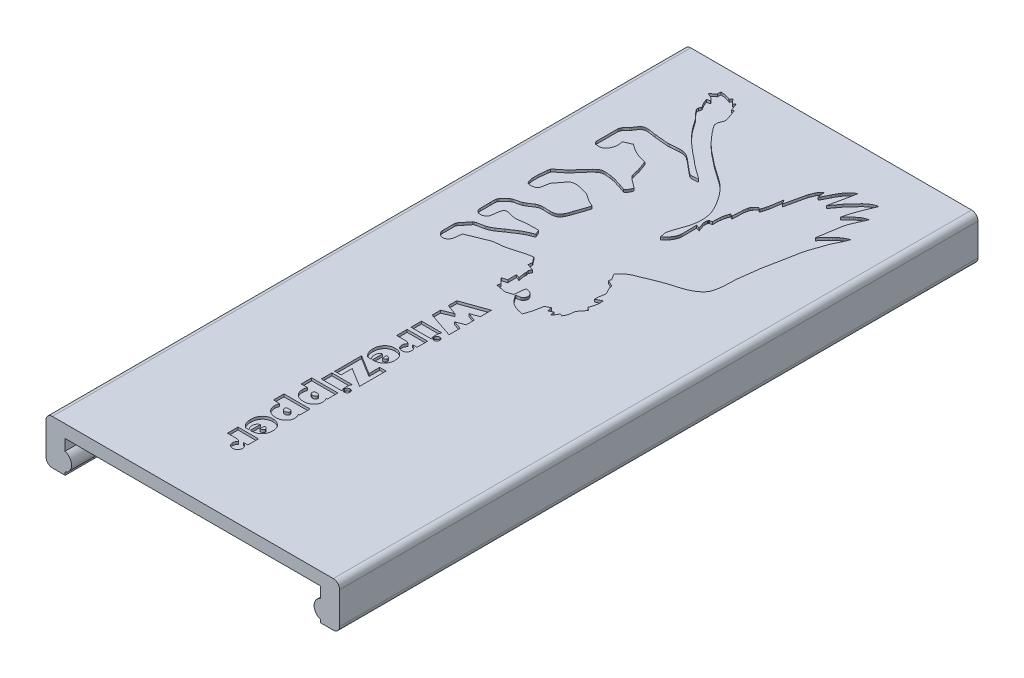
from build123d import *

# Parameters (mm, degrees)
BOSS_EXTRUDE1_DEPTH = 50
CUT_EXTRUDE1_DEPTH  = 0.2
CUT_EXTRUDE3_DEPTH  = 0.2


with BuildPart() as part:
    # Sketch1 → Boss-Extrude1 (new body)
    with BuildSketch(Plane.XY):
        with BuildLine():
            Line((21.5, 0), (22.5, 0))
            ThreePointArc((22.5, 0), (22.853553391, 0.146446609), (23, 0.5))
            Line((23, 0.5), (23, 3))
            ThreePointArc((23, 3), (22.853553391, 3.353553391), (22.5, 3.5))
            Line((22.5, 3.5), (0.5, 3.5))
            ThreePointArc((0.5, 3.5), (0.146446609, 3.353553391), (0, 3))
            Line((0, 3), (0, 0.5))
            ThreePointArc((0, 0.5), (0.146446609, 0.146446609), (0.5, 0))
            Line((0.5, 0), (1.5, 0))
            Line((1.5, 0), (1.5, 0.22281926))
            ThreePointArc((1.5, 0.22281926), (2, 0.929926042), (1.5, 1.637032823))
            Line((1.5, 1.637032823), (1.5, 2.5))
            Line((1.5, 2.5), (21.5, 2.5))
            Line((21.5, 2.5), (21.5, 1.637032823))
            ThreePointArc((21.5, 1.637032823), (21, 0.929926042), (21.5, 0.22281926))
            Line((21.5, 0.22281926), (21.5, 0))
        make_face()
    extrude(amount=BOSS_EXTRUDE1_DEPTH)

    # Sketch2 → Cut-Extrude1 (cut)
    with BuildSketch(Plane(origin=(0, 3.5, -61.263245551), x_dir=(1, 0, 0), z_dir=(0, 1, 0))):
        Polygon((19.745567043, -68.104601105), (19.771329957, -68.016192319), (19.70560115, -68.038746064), (19.64138336, -68.063779757), (19.578619421, -68.091182355), (19.517252165, -68.120842815), (19.457224424, -68.152650096), (19.39847903, -68.186493155), (19.340958816, -68.22226095), (19.284606615, -68.25984244), (19.229365259, -68.299126581), (19.175177579, -68.340002332), (19.12198641, -68.382358651), (19.069734583, -68.426084496), (19.018364931, -68.471068823), (18.918043479, -68.564368759), (18.772748422, -68.710981234), (18.269777505, -69.271361386), (18.281217218, -69.152948654), (18.534959056, -67.569138215), (18.544005901, -67.509503112), (18.554730191, -67.450416977), (18.56703761, -67.391848979), (18.580833842, -67.333768285), (18.612515474, -67.218945481), (18.649020551, -67.105701905), (18.711171581, -66.93825803), (19.047435047, -66.172036884), (19.133726594, -65.94994016), (19.076628488, -65.960005663), (19.0210055, -65.972912087), (18.966794939, -65.988522881), (18.913934115, -66.006701499), (18.862360336, -66.027311391), (18.812010911, -66.05021601), (18.762823149, -66.075278807), (18.71473436, -66.102363235), (18.667681851, -66.131332743), (18.621602933, -66.162050786), (18.576434914, -66.194380813), (18.532115103, -66.228186277), (18.445769342, -66.299677323), (18.362064121, -66.375431536), (18.200569188, -66.535359923), (17.84770658, -66.896305725), (17.884657267, -66.736955957), (17.968344054, -66.421133138), (18.063839559, -66.108907692), (18.225973101, -65.646689184), (18.633040198, -64.666178627), (18.599411796, -64.669771971), (18.533227498, -64.680575674), (18.468456628, -64.695924518), (18.405079291, -64.715485446), (18.312582633, -64.751995932), (18.2231095, -64.796110162), (18.080524168, -64.883478066), (17.794211119, -65.113398916), (17.069099288, -65.909145003), (16.828722484, -66.241607928), (16.513006588, -66.656341035), (16.794160411, -65.369006265), (16.941861286, -64.59631034), (16.870777867, -64.636264025), (16.802816891, -64.679249232), (16.737833191, -64.725113573), (16.675681599, -64.773704659), (16.616216947, -64.824870101), (16.559294067, -64.87845751), (16.504767792, -64.934314498), (16.452492954, -64.992288676), (16.402324385, -65.052227654), (16.354116917, -65.113979045), (16.307725383, -65.177390459), (16.263004615, -65.242309509), (16.219809445, -65.308583804), (16.177994705, -65.376060956), (16.097925845, -65.514014276), (15.98454659, -65.726155966), (15.693970925, -66.293387042), (15.617711182, -66.428936729), (15.54903134, -65.848423204), (15.522460267, -65.865064365), (15.472343148, -65.901302245), (15.426048379, -65.941194805), (15.383322735, -65.984398764), (15.34391299, -66.030570845), (15.290461754, -66.104643271), (15.228435653, -66.210590997), (15.076480483, -66.580017015), (15.040869472, -66.693542611), (14.686293126, -68.258406048), (14.474940792, -67.937489416), (14.445551284, -68.104829917), (14.310577684, -68.947591988), (14.271183579, -69.113223294), (14.240015457, -69.222374291), (14.204192452, -69.330305289), (14.163088355, -69.436841345), (14.140360206, -69.489531601), (14.116076957, -69.541807517), (13.981394714, -69.409464834), (13.758050972, -69.632820298), (13.676716055, -69.754194358), (13.642544144, -69.830846835), (13.624269592, -69.89243466), (13.614813809, -69.932350891), (13.591969798, -70.052722709), (13.568864821, -70.255035201), (13.529664818, -71.070500793), (13.334094675, -70.96058259), (13.302168255, -71.042533388), (13.24802945, -71.209136729), (13.206156478, -71.378791597), (13.169809605, -71.594144463), (13.14752875, -71.855680811), (13.149463132, -72.206015635), (12.963703448, -72.245338409), (12.919499216, -72.274044131), (12.898916729, -72.298983789), (12.888280793, -72.319488077), (12.880455427, -72.34346579), (12.874040289, -72.372947136), (12.865584292, -72.431757942), (12.862523692, -72.490347444), (12.864334122, -72.548693093), (12.870491214, -72.606772342), (12.893747912, -72.722041444), (13.055767611, -73.167952174), (12.76260984, -73.058920113), (12.772836021, -74.2235194), (12.769441063, -74.267985594), (12.764247026, -74.311940293), (12.757306122, -74.355374587), (12.748670559, -74.398279565), (12.738392549, -74.440646318), (12.7265243, -74.482465934), (12.713118023, -74.523729503), (12.698225927, -74.564428116), (12.681900222, -74.604552862), (12.664193119, -74.644094829), (12.624843556, -74.721394791), (12.580594918, -74.796256719), (12.531864882, -74.868609329), (12.479071129, -74.938381339), (12.422631337, -75.005501468), (12.332049001, -75.10105345), (12.235612524, -75.190237731), (12.134731573, -75.272813733), (12.046286421, -74.820815745), (12.0572263, -74.751406038), (12.070060076, -74.682497303), (12.08463885, -74.614050506), (12.100813721, -74.546026613), (12.137356163, -74.411091404), (12.200418082, -74.210884521), (12.455179307, -73.483307548), (12.495149159, -73.349414391), (12.530187067, -73.214246266), (12.545484294, -73.146086506), (12.559101837, -73.077490902), (12.570890798, -73.008420419), (12.580702278, -72.938836025), (12.588387376, -72.868698685), (12.59464246, -72.810642899), (12.603824389, -72.694131792), (12.608519809, -72.577268101), (12.608670092, -72.460267982), (12.604216612, -72.343347591), (12.595100741, -72.226723086), (12.581263852, -72.110610622), (12.562647316, -71.995226355), (12.539192508, -71.880786442), (12.510840798, -71.767507038), (12.47753356, -71.655604302), (12.439212167, -71.545294387), (12.39581799, -71.436793452), (12.347292403, -71.330317652), (12.293576778, -71.226083144), (12.153611462, -70.972593632), (12.055622325, -70.8055721), (11.953676271, -70.640627802), (11.847590064, -70.478189353), (11.737180466, -70.318685371), (11.622264242, -70.162544472), (11.563058883, -70.085869122), (11.502658155, -70.010195274), (11.441039151, -69.935576505), (11.378178968, -69.862066392), (11.314054701, -69.789718512), (11.248643446, -69.718586443), (11.181922298, -69.648723762), (11.113868352, -69.580184045), (11.044458704, -69.513020869), (10.973670449, -69.447287813), (10.901480682, -69.383038452), (10.8278665, -69.320326365), (10.752804998, -69.259205127), (10.676273271, -69.199728316), (10.598248414, -69.14194951), (10.518707523, -69.085922285), (9.445158783, -68.330045283), (9.377323265, -68.286704215), (8.529964041, -67.61150044), (8.336111467, -67.454739788), (8.147528972, -67.291868199), (7.90408908, -67.065842996), (7.669551492, -66.830496664), (7.443649508, -66.586710778), (7.173009545, -66.271453322), (6.864769026, -65.879980377), (6.709729802, -65.656858788), (6.656644684, -65.543795663), (6.640724685, -65.474324633), (6.637953976, -65.419306649), (6.637039488, -65.393399508), (6.637876621, -65.367752405), (6.640315856, -65.342344663), (6.649402561, -65.292164545), (6.663103453, -65.24269372), (6.767484106, -64.975890107), (6.787730528, -64.902361955), (6.795283594, -64.852609955), (6.796828208, -64.827451949), (6.796685517, -64.802078367), (6.794706002, -64.77646853), (6.790740146, -64.75060176), (6.78463843, -64.724457376), (6.776251336, -64.698014701), (6.478949583, -63.833852049), (6.316198754, -63.871944585), (6.081407246, -63.266668763), (5.943714714, -63.442255947), (5.617870925, -63.080333737), (5.499302591, -63.247135679), (5.418185032, -63.212665539), (5.083167801, -63.109789756), (4.852038362, -63.078852692), (4.675548278, -63.079290725), (4.667182278, -63.332341528), (4.3028609, -63.683744915), (4.436380901, -63.74543469), (4.682235799, -63.862000094), (4.740558774, -63.903978471), (4.775654331, -63.93618192), (4.807122862, -63.972386928), (4.821336845, -63.992158035), (4.834451894, -64.013131153), (4.846403949, -64.035373491), (4.857128952, -64.058952255), (4.866562843, -64.083934652), (4.619415738, -64.138096574), (4.636424293, -64.21830065), (4.696572924, -64.397852828), (4.954743423, -64.842439101), (4.882509129, -65.057092669), (4.880850914, -65.175763412), (4.901269108, -65.22048276), (4.962643763, -65.325273315), (5.32889596, -65.714175511), (5.354305854, -65.737196295), (5.426177903, -65.809786685), (5.534157903, -65.940347595), (5.924220438, -66.497400316), (5.994118086, -66.591179891), (6.065464319, -66.683663429), (6.138209009, -66.774888771), (6.212302028, -66.86489376), (6.287693249, -66.953716237), (6.364332545, -67.041394044), (6.442169787, -67.127965023), (6.521154849, -67.213467015), (6.601237603, -67.297937861), (6.764495676, -67.463937487), (6.931542986, -67.626266632), (7.101978513, -67.785228032), (7.275401236, -67.94112442), (7.540259084, -68.169884333), (8.356211579, -68.829090573), (8.39965809, -68.870721216), (8.488690302, -68.951152824), (8.626852738, -69.065704523), (8.914944993, -69.279321314), (9.595664905, -69.767475131), (9.73351794, -69.882958951), (9.238387712, -69.912079265), (9.122579566, -69.898059871), (9.054333719, -69.880159565), (8.905920839, -69.767554214), (7.90154777, -68.93355232), (7.651348823, -68.749684369), (7.602203888, -68.718777787), (7.552316259, -68.691274341), (7.501727456, -68.667008821), (7.450479005, -68.645816018), (7.398612426, -68.627530719), (7.346169242, -68.611987715), (7.293190978, -68.599021796), (7.239719154, -68.588467749), (7.185795294, -68.580160366), (7.13146092, -68.573934435), (7.076757555, -68.569624746), (7.021726722, -68.567066089), (6.910848742, -68.566541025), (6.743113827, -68.5747559), (6.185203457, -68.626466799), (6.076335393, -68.631387665), (4.991956592, -68.53259847), (4.861058435, -68.514729341), (4.366578875, -68.439300904), (4.267682616, -68.437779177), (4.201866854, -68.441828587), (4.136175391, -68.450643686), (4.070635862, -68.464836967), (4.037931708, -68.474141829), (4.01404608, -68.482781016), (3.991237496, -68.492646738), (3.969449153, -68.503673451), (3.92870599, -68.528947679), (3.891362185, -68.558079357), (3.856963332, -68.590544139), (3.780868317, -68.68284742), (3.574977655, -68.983157009), (3.510176489, -69.065065577), (3.25557439, -69.337636123), (3.211351075, -69.401747679), (3.186726578, -69.44712548), (3.166822765, -69.495060225), (3.158864646, -69.520106327), (3.152354934, -69.545935514), (3.147383041, -69.572595737), (3.14403838, -69.600134946), (3.139952782, -69.65652541), (3.140584749, -71.23861477), (3.144107239, -71.277524794), (3.183718199, -71.405349389), (3.229265505, -71.469694649), (3.269232129, -71.502636865), (3.304427669, -71.520476277), (3.344216436, -71.53134745), (3.61837653, -71.551970824), (3.709675015, -71.543297562), (3.775331899, -71.528081984), (3.817132856, -71.512976279), (3.856966272, -71.493394454), (3.894496742, -71.468902338), (3.91229356, -71.454679244), (3.929388866, -71.439065763), (3.945740734, -71.422007625), (3.961307239, -71.403450559), (3.98937849, -71.373627764), (4.015892902, -71.342811256), (4.040860808, -71.311051795), (4.064292537, -71.278400145), (4.086198421, -71.244907065), (4.106588791, -71.210623319), (4.125473977, -71.175599669), (4.142864311, -71.139886875), (4.158770122, -71.1035357), (4.173201743, -71.066596906), (4.186169503, -71.029121254), (4.197683734, -70.991159506), (4.207754767, -70.952762424), (4.216392932, -70.91398077), (4.223608561, -70.874865306), (4.233813531, -70.795835993), (4.238452325, -70.71608058), (4.237607589, -70.636005163), (4.23136197, -70.556015834), (4.219798116, -70.476518688), (4.202998672, -70.397919821), (4.181046286, -70.320625326), (4.790131131, -70.048376237), (5.224468095, -70.346633618), (5.475077196, -70.486742868), (5.64836071, -70.567299985), (5.78185668, -70.619673541), (5.91856101, -70.664295823), (6.011559556, -70.689357225), (6.441244971, -70.804155975), (6.680255914, -71.473471612), (6.700440152, -71.528410734), (6.744214516, -71.698966386), (6.8305612, -72.101378224), (6.861817271, -72.18289268), (6.887686976, -72.235415575), (6.918328723, -72.286218549), (6.970050687, -72.344544556), (7.108551306, -72.480415089), (7.793872115, -72.991890375), (7.735132038, -73.15174023), (7.645154274, -73.31873513), (7.592514427, -73.38335033), (7.546532614, -73.426319923), (7.494231265, -73.463718165), (7.455521087, -73.485171093), (6.985274076, -73.317712497), (6.413893192, -73.140189722), (6.218812671, -73.098385977), (6.070290228, -73.075536206), (6.002042209, -73.066146668), (5.611704265, -73.021744922), (5.505306074, -73.022135986), (5.435448501, -73.027843033), (5.366821867, -73.038771649), (5.333069605, -73.046425607), (5.299744422, -73.055662833), (5.266886098, -73.06657595), (5.234534417, -73.079257584), (5.202729158, -73.093800359), (5.171510104, -73.110296901), (5.140917036, -73.128839834), (5.110989736, -73.149521784), (5.081767984, -73.172435374), (5.038848794, -73.208166122), (4.914287773, -73.319608788), (4.718279149, -73.517061407), (3.986003167, -74.357903796), (3.433483796, -74.798544394), (3.243243612, -74.988383245), (3.204221159, -75.132149523), (3.132588262, -75.845942829), (3.130799477, -76.252818038), (3.148654304, -76.422002715), (3.168852255, -76.521067461), (3.187151588, -76.585602228), (3.209812025, -76.648656325), (3.237256891, -76.709994933), (3.269909511, -76.769383233), (3.288321017, -76.798272638), (3.329155607, -76.818994217), (3.393163804, -76.84288409), (3.45976748, -76.858628273), (3.551225161, -76.86789309), (3.643973908, -76.864941433), (3.781363878, -76.840439001), (3.931373466, -76.786619478), (3.950191496, -76.76983757), (3.967597017, -76.752250032), (3.983658702, -76.733899947), (4.012025244, -76.695084471), (4.035840485, -76.653735812), (4.055653791, -76.610198638), (4.085472057, -76.517937421), (4.154540692, -76.130285695), (4.157762673, -76.099856406), (4.162628318, -76.070279244), (4.169049296, -76.041508503), (4.176937276, -76.013498481), (4.196760928, -75.959577778), (4.221392631, -75.908151502), (4.265809513, -75.834889324), (4.488060664, -75.565058469), (4.592547696, -75.426797706), (4.768640496, -75.176910233), (4.823399979, -75.126278587), (4.869821171, -75.095667931), (4.903789049, -75.079559916), (4.940466976, -75.067384508), (4.98010671, -75.059564567), (5.021954842, -75.04726225), (5.063804833, -75.037016268), (5.105652668, -75.028734313), (5.147494334, -75.022324076), (5.189325817, -75.017693247), (5.231143104, -75.014749518), (5.272942181, -75.01340058), (5.314719033, -75.013554125), (5.398190011, -75.017999424), (5.481523927, -75.027346945), (5.606197568, -75.048944486), (6.179790772, -75.200372854), (6.239633866, -75.219128046), (6.296962677, -75.242394957), (6.379011919, -75.284391349), (6.533269842, -75.386216596), (6.862349187, -75.617843215), (6.945037614, -75.659721778), (7.352869278, -75.847349819), (7.335319283, -75.927703013), (7.254192511, -76.202650419), (6.985260636, -76.976985108), (6.921800835, -77.174822227), (6.841723584, -77.37132666), (6.79270217, -77.464611689), (6.755947017, -77.523748635), (6.715552076, -77.579825402), (6.671191275, -77.632312519), (6.647421778, -77.657044497), (6.622538539, -77.680680511), (6.596500797, -77.703154375), (6.569267795, -77.724399905), (6.540798772, -77.744350918), (6.511052969, -77.76294123), (6.479989628, -77.780104655), (6.447567989, -77.795775011), (6.40560176, -77.808651938), (6.363432271, -77.819535485), (6.321073302, -77.828565942), (6.278538629, -77.835883599), (6.235842032, -77.841628747), (6.150018177, -77.848962676), (6.020412416, -77.85167701), (5.541917787, -77.834166794), (5.41216609, -77.838595989), (5.326210196, -77.84748146), (5.283437156, -77.854124869), (5.240819091, -77.862422447), (5.198369779, -77.872514485), (5.142932417, -77.892932147), (5.037240988, -77.94319646), (4.595508909, -78.232665262), (4.465771592, -78.301295382), (4.414079725, -78.328559934), (4.360843257, -78.35123264), (4.250771412, -78.385854041), (3.854897238, -78.474529346), (3.773689965, -78.503975684), (3.721286266, -78.528674252), (3.670571997, -78.55831699), (3.616155246, -78.595331521), (3.217410772, -79.00059091), (3.19317992, -79.036269035), (3.173696418, -79.073379124), (3.152297456, -79.131367032), (3.135794606, -79.212150909), (3.130301383, -79.59056065), (3.131677235, -79.625378652), (3.13515924, -80.361202792), (3.153164243, -80.499456743), (3.175475562, -80.602089762), (3.194897118, -80.632702863), (3.216551099, -80.660694146), (3.240262865, -80.686093336), (3.265857778, -80.70893016), (3.2931612, -80.729234343), (3.32199849, -80.747035611), (3.35219501, -80.762363689), (3.383576122, -80.775248304), (3.415967186, -80.785719181), (3.449193564, -80.793806045), (3.483080616, -80.799538623), (3.517453704, -80.80294664), (3.552138188, -80.804059822), (3.586959431, -80.802907895), (3.621742792, -80.799520584), (3.656313633, -80.793927616), (3.690497316, -80.786158715), (3.724119201, -80.776243608), (3.757004649, -80.76421202), (3.788979022, -80.750093677), (3.819867681, -80.733918305), (3.849495986, -80.71571563), (3.877689299, -80.695515377), (3.90427298, -80.673347272), (3.929072392, -80.649241041), (3.951912895, -80.62322641), (3.97261985, -80.595333103), (3.991018618, -80.565590848), (4.006934561, -80.534029369), (4.026658772, -80.468509876), (4.041958321, -80.401577975), (4.093602475, -79.987461307), (4.118134233, -79.851994599), (4.136012084, -79.786120475), (4.158887552, -79.72189382), (4.17249384, -79.690493915), (4.187702868, -79.659620623), (4.204632414, -79.629312193), (4.223400257, -79.599606872), (4.244124176, -79.57054291), (4.294322886, -79.560046044), (4.394477249, -79.549496262), (4.519018866, -79.553175896), (4.956959152, -79.660275724), (4.993137986, -79.67044278), (5.029338755, -79.678827737), (5.06556032, -79.685532985), (5.10180154, -79.690660915), (5.138061278, -79.694313918), (5.210631748, -79.697604709), (5.283262616, -79.696224487), (5.392302227, -79.687187846), (5.901775676, -79.611653552), (6.010888162, -79.605724838), (6.910724574, -79.583092112), (7.079993608, -79.979697301), (6.960640786, -80.018349236), (6.843254235, -80.061514076), (6.727725219, -80.108861548), (6.557676714, -80.187002723), (6.391196025, -80.272697043), (6.17413742, -80.396778888), (5.497482708, -80.847161933), (5.050235161, -81.163132955), (4.845481788, -81.276636507), (4.702724052, -81.339200331), (4.591832195, -81.377593303), (4.515905719, -81.398582916), (3.962451456, -81.509870343), (3.836287705, -81.55399255), (3.763557986, -81.589752309), (3.421766696, -82.024454199), (3.230115071, -82.262994818), (3.189620962, -82.341215118), (3.174230893, -82.391897064), (3.168589007, -82.427579253), (3.16714966, -82.464962643), (3.169082441, -83.369377327), (3.171152539, -83.404791173), (3.176253231, -83.439743518), (3.184234647, -83.474111917), (3.194946916, -83.507773927), (3.208240169, -83.540607104), (3.223964534, -83.572489007), (3.241970142, -83.60329719), (3.262107121, -83.632909211), (3.284225601, -83.661202627), (3.308175713, -83.688054993), (3.333807585, -83.713343867), (3.360971347, -83.736946806), (3.389517129, -83.758741365), (3.41929506, -83.778605102), (3.45015527, -83.796415573), (3.481947888, -83.812050335), (3.514523044, -83.825386944), (3.547730868, -83.836302957), (3.581421489, -83.844675931), (3.615445037, -83.850383422), (3.649651641, -83.853302987), (3.683891431, -83.853312183), (3.718014536, -83.850288566), (3.751871086, -83.844109693), (3.785311211, -83.834653121), (3.81818504, -83.821796405), (3.850342703, -83.805417104), (3.881634329, -83.785392772), (3.911910048, -83.761600968), (3.941627115, -83.738549129), (3.968555703, -83.714125817), (3.992849747, -83.688409762), (4.014663184, -83.66147969), (4.034149948, -83.633414329), (4.051463973, -83.604292407), (4.066759197, -83.574192652), (4.080189553, -83.543193792), (4.091908977, -83.511374553), (4.102071403, -83.478813665), (4.110830768, -83.445589854), (4.124756052, -83.377468376), (4.162536714, -83.023853064), (4.178529719, -82.921216849), (4.194234668, -82.855645098), (4.204061831, -82.823951123), (5.709166827, -82.208816781), (5.745468392, -82.195717217), (5.818706943, -82.173175852), (5.929944577, -82.147271155), (6.156009482, -82.115763661), (6.687170783, -82.058997138), (6.798940154, -82.033761003), (6.921100642, -82.008515318), (7.102783459, -81.963377734), (7.942165958, -81.715913405), (8.123883521, -81.672704643), (8.246073986, -81.64912304), (8.369302006, -81.630693129), (8.431358997, -81.623670497), (8.493740054, -81.618248314), (8.556466735, -81.614530755), (8.872641196, -82.023266092), (8.847383583, -82.360020721), (9.365290519, -82.508550236), (9.235963053, -82.755180236), (9.30174099, -82.920386313), (9.291343064, -82.965881161), (9.283217409, -83.033851223), (9.283864284, -83.124082108), (9.357134099, -83.57422359), (9.058292573, -83.474445045), (9.070313767, -84.164851175), (8.674314613, -84.279138404), (9.075376023, -84.693660343), (9.004267543, -84.946211574), (9.797893144, -85.091875963), (10.299309972, -84.918726798), (10.302590804, -84.888892866), (10.362134706, -84.257198502), (10.392402408, -84.140493295), (10.4238157, -84.054795842), (10.452761583, -84.053395865), (10.48270627, -84.054232149), (10.513454488, -84.057230867), (10.544810964, -84.062318192), (10.576580425, -84.069420299), (10.608567599, -84.078463359), (10.640577212, -84.089373546), (10.672413991, -84.102077034), (10.703882664, -84.116499996), (10.734787958, -84.132568605), (10.764934599, -84.150209034), (10.794127315, -84.169347457), (10.822170833, -84.189910047), (10.84886988, -84.211822978), (10.874029183, -84.235012421), (10.897453468, -84.259404552), (10.918947464, -84.284925543), (10.938315897, -84.311501567), (10.955363494, -84.339058797), (10.969894983, -84.367523408), (10.98171509, -84.396821571), (10.990628542, -84.426879461), (10.996440067, -84.457623251), (10.998954391, -84.488979114), (10.997976242, -84.520873223), (10.993310347, -84.553231752), (10.984761433, -84.585980873), (10.972134227, -84.619046761), (10.955233455, -84.652355588), (10.946900708, -84.675901271), (10.937122571, -84.697505549), (10.925975944, -84.717267722), (10.913537725, -84.735287091), (10.899884813, -84.751662955), (10.885094105, -84.766494615), (10.869242501, -84.779881371), (10.852406898, -84.791922524), (10.834664196, -84.802717374), (10.796765085, -84.820965366), (10.735035629, -84.841472587), (10.468766526, -84.891767434), (10.407742715, -84.909813177), (10.632654551, -85.215101293), (10.856289859, -85.482768493), (10.94391904, -85.559685488), (11.007478361, -85.597529103), (11.238912997, -85.713053186), (11.51691899, -85.814885234), (11.949543592, -85.913752266), (12.142914428, -85.340516337), (12.268622202, -84.704727993), (12.270172263, -84.682613028), (12.273394104, -84.661654343), (12.278202913, -84.641799733), (12.284513875, -84.622996995), (12.292242176, -84.605193922), (12.301303003, -84.588338312), (12.32308298, -84.55726066), (12.349175294, -84.529346403), (12.378901438, -84.504177905), (12.428819842, -84.470659881), (12.682407584, -84.342088626), (12.736615276, -84.712836608), (13.058275473, -84.546878528), (13.138678392, -84.839029217), (13.15619516, -84.830826961), (13.188655655, -84.812000098), (13.231520718, -84.778313524), (13.27949892, -84.724938588), (13.440817098, -84.41633767), (13.632120999, -84.500552553), (13.75384145, -84.259790443), (13.818074028, -84.056258307), (13.84273201, -83.897648818), (13.845714599, -83.761784673), (13.855415492, -83.734454161), (13.889406923, -83.655010608), (13.944616533, -83.554313431), (14.320152096, -83.076569037), (14.06605127, -82.885197209), (14.098786875, -82.818870429), (14.141116363, -82.717192121), (14.175841778, -82.613213385), (14.211333893, -82.471629225), (14.244252884, -82.254702703), (14.255583412, -81.85169457), (13.769921082, -82.077886878), (13.767131001, -81.988319314), (13.774855998, -81.869942166), (13.859551467, -81.343553664), (13.863599826, -81.226018561), (13.63271354, -80.803171682), (13.598279053, -80.702891724), (13.581417493, -80.624274459), (13.575291626, -80.569914619), (13.573784579, -80.513793389), (13.044000725, -80.267249877), (13.143231585, -80.107359869), (12.879349072, -79.691964097), (12.846268149, -79.593671721), (12.895346802, -79.536538831), (13.133480095, -79.294607686), (13.308790367, -79.152128919), (13.465607452, -79.048500383), (13.598379918, -78.977255637), (13.702367947, -78.93144955), (15.214345303, -78.327294979), (15.618309027, -78.185406688), (15.863997926, -78.109643113), (16.029493375, -78.063956105), (16.35909275, -77.961655427), (16.624715944, -77.868975237), (16.755920195, -77.817254558), (16.884959432, -77.761089918), (16.948410893, -77.731140275), (17.011013567, -77.699838637), (17.072664943, -77.667104669), (17.13326251, -77.632858035), (17.192703758, -77.597018403), (17.250886175, -77.559505435), (17.307707249, -77.520238797), (17.363064471, -77.479138156), (17.416855329, -77.436123174), (17.468977312, -77.391113518), (17.519327909, -77.344028853), (17.567804609, -77.294788844), (17.614304901, -77.243313156), (17.658726274, -77.189521454), (17.700966217, -77.133333402), (17.740922218, -77.074668667), (17.768709081, -77.008887079), (17.794040451, -76.942566934), (17.817040611, -76.87573761), (17.837833847, -76.808428488), (17.856544442, -76.740668949), (17.873296682, -76.672488371), (17.888214851, -76.603916135), (17.901423233, -76.534981622), (17.913046113, -76.46571421), (17.923207776, -76.396143281), (17.939644586, -76.256208387), (17.95172794, -76.115411982), (17.984800059, -75.336135569), (18.0039464, -75.055702584), (18.21790855, -73.436569234), (18.646280749, -71.241641808), (18.668328165, -71.098314098), (18.694877755, -70.956082083), (18.74224461, -70.744591426), (18.817321843, -70.465598008), (19.238999652, -69.233892702), (19.288145915, -69.10518097), (19.568730961, -68.526840663), (19.699700683, -68.234226031), align=None)
    extrude(amount=-CUT_EXTRUDE1_DEPTH, mode=Mode.SUBTRACT)

    # Sketch4 → Cut-Extrude3 (cut)
    # profile 1 of 12: a face of its own
    with BuildSketch(Plane(origin=(0, 3.5, 0), x_dir=(1, 0, 0), z_dir=(0, 1, 0))):
        Polygon((8.493740054, -26.975705888), (8.493740054, -26.318284013), (10.493740054, -25.605002763), (10.493740054, -26.476877763), (9.841005679, -26.711252763), (10.493740054, -26.957346513), (10.493740054, -27.577659013), (9.841005679, -27.835862138), (10.493740054, -28.056565263), (10.493740054, -28.930002763), (8.493740054, -28.249924638), (8.493740054, -27.590940263), (9.290224429, -27.272190263), align=None)
    # profile 2 of 12: a face of its own
    with BuildSketch(Plane(origin=(0, 3.5, 0), x_dir=(1, 0, 0), z_dir=(0, 1, 0))):
        with BuildLine():
            add(Edge.make_bspline(
                [(10.068740054, -29.676096513), (10.069574094, -29.661165528), (10.071221442, -29.631674701), (10.084096682, -29.589293469), (10.105515009, -29.550326618), (10.13462238, -29.515815962), (10.169201583, -29.48656195), (10.208321787, -29.465470875), (10.250593047, -29.452335835), (10.279973554, -29.45073737), (10.294911929, -29.449924638)],
                knots=[0, 0, 0, 0, 1.009378599, 1.993666835, 2.967841641, 4.000348654, 5.032855666, 6.014773643, 6.990621401, 8, 8, 8, 8], degree=3))
            add(Edge.make_bspline(
                [(10.294911929, -29.449924638), (10.309849642, -29.450740151), (10.339228849, -29.452344086), (10.381399294, -29.465404893), (10.420219205, -29.486468257), (10.454044033, -29.515978469), (10.482824898, -29.550319133), (10.503671884, -29.589405137), (10.516771828, -29.631640986), (10.518078671, -29.66115812), (10.518740054, -29.676096513)],
                knots=[0, 0, 0, 0, 1.0134126, 1.993160351, 2.971228465, 3.994329448, 5.02532064, 5.999176987, 6.98739895, 8, 8, 8, 8], degree=3))
            add(Edge.make_bspline(
                [(10.518740054, -29.676096513), (10.518096824, -29.691040947), (10.516831235, -29.720444951), (10.503555018, -29.762480685), (10.48303268, -29.801378533), (10.454017161, -29.83512122), (10.419966038, -29.863692209), (10.381495659, -29.884979976), (10.339148091, -29.897374503), (10.309834932, -29.899064354), (10.294911929, -29.899924638)],
                knots=[0, 0, 0, 0, 1.017177303, 2.001352833, 2.979610333, 4.001591882, 5.017875578, 6.00036388, 6.98200748, 8, 8, 8, 8], degree=3))
            add(Edge.make_bspline(
                [(10.294911929, -29.899924638), (10.279988196, -29.899067176), (10.250673605, -29.897382868), (10.208225618, -29.884915333), (10.169452081, -29.863594262), (10.134654283, -29.835282417), (10.105305336, -29.801374209), (10.084214637, -29.762591623), (10.071160977, -29.720411418), (10.069556064, -29.691033547), (10.068740054, -29.676096513)],
                knots=[0, 0, 0, 0, 1.013893472, 1.991584386, 2.977894406, 4.003775212, 5.027361664, 6.005893879, 6.986106528, 8, 8, 8, 8], degree=3))
        make_face()
    # profile 3 of 12: a face of its own
    with BuildSketch(Plane(origin=(0, 3.5, 0), x_dir=(1, 0, 0), z_dir=(0, 1, 0))):
        with BuildLine():
            Line((10.093740054, -29.905002763), (8.493740054, -29.905002763))
            Line((8.493740054, -29.905002763), (8.493740054, -29.080002763))
            Line((8.493740054, -29.080002763), (10.093740054, -29.080002763))
            add(Edge.make_bspline(
                [(10.093740054, -29.080002763), (10.085669549, -29.093930457), (10.069295049, -29.122188794), (10.049184388, -29.167818448), (10.032035076, -29.216281084), (10.017889582, -29.267838788), (10.007110167, -29.322424661), (9.999370507, -29.37995324), (9.994569345, -29.440467766), (9.994021421, -29.481816471), (9.993740054, -29.503049638)],
                knots=[0, 0, 0, 0, 0.877200649, 1.779780104, 2.71397693, 3.67857263, 4.692272687, 5.74560382, 6.842334481, 8, 8, 8, 8], degree=3))
            add(Edge.make_bspline(
                [(9.993740054, -29.503049638), (9.994027934, -29.522720818), (9.994593104, -29.561339472), (9.999394978, -29.61808046), (10.007086156, -29.672368415), (10.017982965, -29.724069899), (10.032089363, -29.773157647), (10.04923681, -29.819671477), (10.069486362, -29.863786507), (10.085692482, -29.891326875), (10.093740054, -29.905002763)],
                knots=[0, 0, 0, 0, 1.124996517, 2.208604206, 3.254495079, 4.25946492, 5.228266681, 6.173185239, 7.092847464, 8, 8, 8, 8], degree=3))
        make_face()
    # profile 4 of 12: a face of its own
    with BuildSketch(Plane(origin=(0, 3.5, 0), x_dir=(1, 0, 0), z_dir=(0, 1, 0))):
        with BuildLine():
            add(Edge.make_bspline(
                [(9.745693179, -31.030002763), (9.760875817, -31.03647376), (9.790525967, -31.049110959), (9.832696352, -31.07049217), (9.872297627, -31.092110285), (9.908739612, -31.115329383), (9.942416438, -31.139397959), (9.973011111, -31.164949602), (10.000731026, -31.191397462), (10.025571869, -31.2189299), (10.047513946, -31.247534165), (10.066802531, -31.277207243), (10.082797829, -31.308119877), (10.095873764, -31.340154613), (10.105886237, -31.373272945), (10.113443129, -31.407327552), (10.117781303, -31.442521093), (10.118416521, -31.46631925), (10.118740054, -31.478440263)],
                knots=[0, 0, 0, 0, 1.272947967, 2.485937938, 3.646070252, 4.752461798, 5.817491216, 6.837459618, 7.825055744, 8.771109415, 9.695364672, 10.603761161, 11.49788128, 12.376517629, 13.269451874, 14.164023341, 15.064889935, 16, 16, 16, 16], degree=3))
            add(Edge.make_bspline(
                [(10.118740054, -31.478440263), (10.118477903, -31.491866824), (10.117964331, -31.518170372), (10.112819734, -31.556665953), (10.104028082, -31.593196428), (10.092646022, -31.628280098), (10.076493253, -31.661002102), (10.058420284, -31.692737828), (10.03583506, -31.721901686), (10.010495979, -31.749253894), (9.982661173, -31.774022976), (9.952624308, -31.795854423), (9.920732868, -31.814044761), (9.887001835, -31.829154717), (9.851537136, -31.840857484), (9.814078804, -31.848930979), (9.77488368, -31.854267041), (9.748055172, -31.854754183), (9.734365054, -31.855002763)],
                knots=[0, 0, 0, 0, 1.068321857, 2.092915352, 3.083392302, 4.056803988, 5.021068689, 5.982711963, 6.959043587, 7.949086641, 8.947502873, 9.919810416, 10.899382301, 11.864370819, 12.857447167, 13.865819438, 14.91096497, 16, 16, 16, 16], degree=3))
            add(Edge.make_bspline(
                [(9.734365054, -31.855002763), (9.720155493, -31.854750262), (9.692291869, -31.854255131), (9.651656929, -31.848982177), (9.613083737, -31.840839118), (9.576596981, -31.829461577), (9.541937001, -31.815045913), (9.509517784, -31.796998517), (9.479071804, -31.775738368), (9.451273383, -31.751163591), (9.425675316, -31.724369591), (9.403907247, -31.694966016), (9.385250927, -31.663720766), (9.370067293, -31.630582137), (9.358269305, -31.595337832), (9.349696951, -31.558207484), (9.344507359, -31.518952258), (9.343999305, -31.492128141), (9.343740054, -31.478440263)],
                knots=[0, 0, 0, 0, 1.116703655, 2.189751872, 3.215862479, 4.213223321, 5.190572813, 6.162113662, 7.124984703, 8.104476803, 9.074992165, 10.033280158, 10.974405702, 11.931872986, 12.893436813, 13.891795567, 14.924220135, 16, 16, 16, 16], degree=3))
            add(Edge.make_bspline(
                [(9.343740054, -31.478440263), (9.344212327, -31.462792266), (9.345145432, -31.431875372), (9.351915209, -31.386291433), (9.363169536, -31.342373135), (9.379359773, -31.300401204), (9.399913888, -31.260077562), (9.424979233, -31.221533056), (9.45429356, -31.184373944), (9.477075318, -31.162056402), (9.488661929, -31.150705888)],
                knots=[0, 0, 0, 0, 1.017403478, 2.010158639, 2.989826744, 3.96011806, 4.929596148, 5.927825441, 6.946109499, 8, 8, 8, 8], degree=3))
            add(Edge.make_bspline(
                [(9.488661929, -31.150705888), (9.479451162, -31.141002054), (9.46051815, -31.121055527), (9.425491339, -31.096671701), (9.385110625, -31.075890739), (9.339089, -31.058747428), (9.287333762, -31.04570027), (9.229958726, -31.03645194), (9.167018132, -31.031125556), (9.123177561, -31.030386874), (9.100380679, -31.030002763)],
                knots=[0, 0, 0, 0, 0.765417932, 1.573339815, 2.431436092, 3.364572883, 4.382128498, 5.486659779, 6.693075379, 8, 8, 8, 8], degree=3))
            Line((9.100380679, -31.030002763), (8.493740054, -31.030002763))
            Line((8.493740054, -31.030002763), (8.493740054, -30.205002763))
            Line((8.493740054, -30.205002763), (10.093740054, -30.205002763))
            Line((10.093740054, -30.205002763), (10.093740054, -31.030002763))
            Line((10.093740054, -31.030002763), (9.745693179, -31.030002763))
        make_face()
    # profile 5 of 12: a face of its own
    with BuildSketch(Plane(origin=(0, 3.5, 0), x_dir=(1, 0, 0), z_dir=(0, 1, 0))):
        with BuildLine():
            Line((9.118740054, -33.630002763), (8.831240054, -33.630002763))
            add(Edge.make_bspline(
                [(8.831240054, -33.630002763), (8.816513997, -33.618852823), (8.78729212, -33.596727267), (8.746264628, -33.560624702), (8.708034716, -33.522695859), (8.672251809, -33.483295467), (8.639788609, -33.441662923), (8.610132397, -33.398294777), (8.583050088, -33.353208236), (8.558705477, -33.306327002), (8.537776305, -33.257382985), (8.519267177, -33.206819664), (8.503770915, -33.154475114), (8.49069124, -33.100416285), (8.481088228, -33.044405959), (8.474082872, -32.986524041), (8.469700637, -32.926814471), (8.469062752, -32.886390353), (8.468740054, -32.865940263)],
                knots=[0, 0, 0, 0, 1.006935666, 1.998128321, 2.977141687, 3.942387175, 4.89826482, 5.853403846, 6.80560914, 7.764619567, 8.731404501, 9.706212254, 10.699107226, 11.706543407, 12.737254108, 13.795809263, 14.88492557, 16, 16, 16, 16], degree=3))
            add(Edge.make_bspline(
                [(8.468740054, -32.865940263), (8.469335451, -32.832442672), (8.470497191, -32.767082225), (8.481879251, -32.671612134), (8.499469091, -32.581065318), (8.524999971, -32.495564348), (8.557435641, -32.415055245), (8.597142208, -32.33949554), (8.644033251, -32.268864438), (8.698464504, -32.204215328), (8.758310612, -32.145745088), (8.823144645, -32.094494124), (8.892722991, -32.051250276), (8.966928597, -32.016020036), (9.045628234, -31.988490441), (9.128911788, -31.969113488), (9.216827479, -31.957112434), (9.277034141, -31.955716269), (9.307802554, -31.955002763)],
                knots=[0, 0, 0, 0, 1.152387093, 2.248535895, 3.304029504, 4.323442358, 5.314538336, 6.286721634, 7.256164124, 8.226403797, 9.189778641, 10.131107738, 11.064983361, 12.003064201, 12.952623945, 13.928713741, 14.941476128, 16, 16, 16, 16], degree=3))
            add(Edge.make_bspline(
                [(9.307802554, -31.955002763), (9.337005899, -31.955615292), (9.394323985, -31.956817517), (9.478132278, -31.968110699), (9.557818608, -31.985930545), (9.633422784, -32.010996975), (9.704768428, -32.043531069), (9.771968142, -32.08333241), (9.835302051, -32.129929226), (9.893393604, -32.183893904), (9.946747115, -32.242804968), (9.992305552, -32.307427371), (10.031924884, -32.375538044), (10.063485713, -32.448563913), (10.088659355, -32.525531295), (10.106011031, -32.606979657), (10.116841722, -32.692469549), (10.1180984, -32.750932905), (10.118740054, -32.780784013)],
                knots=[0, 0, 0, 0, 1.077444665, 2.114725699, 3.115107956, 4.087802924, 5.049187725, 6.003688223, 6.965901592, 7.945506269, 8.925770961, 9.894003046, 10.858542198, 11.829168939, 12.824690449, 13.842799004, 14.89854357, 16, 16, 16, 16], degree=3))
            add(Edge.make_bspline(
                [(10.118740054, -32.780784013), (10.118005138, -32.811419019), (10.116557897, -32.87174734), (10.104623368, -32.960613369), (10.084546221, -33.045922367), (10.057491398, -33.127764325), (10.022150877, -33.204974362), (9.979492067, -33.277237013), (9.929168481, -33.344051073), (9.871776923, -33.404802371), (9.80845592, -33.459204616), (9.739794954, -33.50642004), (9.665946625, -33.545543185), (9.586654519, -33.577323068), (9.500384192, -33.60097658), (9.406032087, -33.618076845), (9.302808466, -33.628052005), (9.231001854, -33.629336312), (9.193740054, -33.630002763)],
                knots=[0, 0, 0, 0, 1.03365245, 2.035531405, 3.019408884, 3.988014655, 4.939806357, 5.879632809, 6.814793446, 7.756754517, 8.694812135, 9.62729463, 10.563074592, 11.509688361, 12.504497063, 13.576765824, 14.742538237, 16, 16, 16, 16], degree=3))
            Line((9.193740054, -33.630002763), (9.193740054, -32.828830888))
            add(Edge.make_bspline(
                [(9.193740054, -32.828830888), (9.174937677, -32.836685681), (9.138070129, -32.852087295), (9.088516651, -32.885495157), (9.044961388, -32.925555021), (9.008785849, -32.97309471), (8.979991665, -33.025713792), (8.958933405, -33.082512858), (8.946211491, -33.142982184), (8.944572554, -33.184629303), (8.943740054, -33.205784013)],
                knots=[0, 0, 0, 0, 1.01165888, 1.98365254, 2.955430311, 3.944033132, 4.941320771, 5.929244198, 6.948156836, 8, 8, 8, 8], degree=3))
            add(Edge.make_bspline(
                [(8.943740054, -33.205784013), (8.944231103, -33.227297512), (8.945190184, -33.269316067), (8.953698512, -33.330781367), (8.967059149, -33.388980747), (8.986538393, -33.443907725), (9.011026177, -33.495658521), (9.041493174, -33.54399967), (9.077055683, -33.589401152), (9.104743682, -33.61636995), (9.118740054, -33.630002763)],
                knots=[0, 0, 0, 0, 1.091047564, 2.130952469, 3.14210887, 4.115795419, 5.082080138, 6.04076932, 7.009602685, 8, 8, 8, 8], degree=3))
        make_face()
        with BuildLine():
            Line((9.468740054, -32.780002763), (9.468740054, -33.130002763))
            add(Edge.make_bspline(
                [(9.468740054, -33.130002763), (9.487409296, -33.128762674), (9.522832707, -33.126409703), (9.572680661, -33.116063387), (9.615855464, -33.099516354), (9.652655358, -33.078255928), (9.682181021, -33.051921003), (9.703602892, -33.021234542), (9.716255996, -32.986397499), (9.717899679, -32.962005194), (9.718740054, -32.949534013)],
                knots=[0, 0, 0, 0, 1.308838714, 2.48341791, 3.548172779, 4.53302872, 5.44294517, 6.295002633, 7.128277083, 8, 8, 8, 8], degree=3))
            add(Edge.make_bspline(
                [(9.718740054, -32.949534013), (9.718045112, -32.938346235), (9.716661087, -32.916065008), (9.703555271, -32.884318279), (9.683007466, -32.855303159), (9.654848072, -32.82898285), (9.619125813, -32.806625731), (9.575443141, -32.790625765), (9.524454069, -32.781547519), (9.488049758, -32.780538154), (9.468740054, -32.780002763)],
                knots=[0, 0, 0, 0, 0.795793144, 1.584876599, 2.412881624, 3.320582657, 4.318997508, 5.401822445, 6.621865392, 8, 8, 8, 8], degree=3))
        make_face(mode=Mode.SUBTRACT)
    # profile 6 of 12: a face of its own
    with BuildSketch(Plane(origin=(0, 3.5, 0), x_dir=(1, 0, 0), z_dir=(0, 1, 0))):
        Polygon((8.993740054, -35.880002763), (8.493740054, -35.880002763), (8.493740054, -33.774924638), (9.993740054, -34.699924638), (9.993740054, -33.855002763), (10.493740054, -33.855002763), (10.493740054, -35.935080888), (8.993740054, -35.010080888), align=None)
    # profile 7 of 12: a face of its own
    with BuildSketch(Plane(origin=(0, 3.5, 0), x_dir=(1, 0, 0), z_dir=(0, 1, 0))):
        with BuildLine():
            add(Edge.make_bspline(
                [(10.068740054, -36.701096513), (10.069574094, -36.686165528), (10.071221442, -36.656674701), (10.084096682, -36.614293469), (10.105515009, -36.575326618), (10.13462238, -36.540815962), (10.169201583, -36.51156195), (10.208321787, -36.490470875), (10.250593047, -36.477335835), (10.279973554, -36.47573737), (10.294911929, -36.474924638)],
                knots=[0, 0, 0, 0, 1.009378599, 1.993666835, 2.967841641, 4.000348654, 5.032855666, 6.014773643, 6.990621401, 8, 8, 8, 8], degree=3))
            add(Edge.make_bspline(
                [(10.294911929, -36.474924638), (10.309849642, -36.475740151), (10.339228849, -36.477344086), (10.381399294, -36.490404893), (10.420219205, -36.511468257), (10.454044033, -36.540978469), (10.482824898, -36.575319133), (10.503671884, -36.614405137), (10.516771828, -36.656640986), (10.518078671, -36.68615812), (10.518740054, -36.701096513)],
                knots=[0, 0, 0, 0, 1.0134126, 1.993160351, 2.971228465, 3.994329448, 5.02532064, 5.999176987, 6.98739895, 8, 8, 8, 8], degree=3))
            add(Edge.make_bspline(
                [(10.518740054, -36.701096513), (10.518096824, -36.716040947), (10.516831235, -36.745444951), (10.503555018, -36.787480685), (10.48303268, -36.826378533), (10.454017161, -36.86012122), (10.419966038, -36.888692209), (10.381495659, -36.909979976), (10.339148091, -36.922374503), (10.309834932, -36.924064354), (10.294911929, -36.924924638)],
                knots=[0, 0, 0, 0, 1.017177303, 2.001352833, 2.979610333, 4.001591882, 5.017875578, 6.00036388, 6.98200748, 8, 8, 8, 8], degree=3))
            add(Edge.make_bspline(
                [(10.294911929, -36.924924638), (10.279988196, -36.924067176), (10.250673605, -36.922382868), (10.208225618, -36.909915333), (10.169452081, -36.888594262), (10.134654283, -36.860282417), (10.105305336, -36.826374209), (10.084214637, -36.787591623), (10.071160977, -36.745411418), (10.069556064, -36.716033547), (10.068740054, -36.701096513)],
                knots=[0, 0, 0, 0, 1.013893472, 1.991584386, 2.977894406, 4.003775212, 5.027361664, 6.005893879, 6.986106528, 8, 8, 8, 8], degree=3))
        make_face()
    # profile 8 of 12: a face of its own
    with BuildSketch(Plane(origin=(0, 3.5, 0), x_dir=(1, 0, 0), z_dir=(0, 1, 0))):
        with BuildLine():
            Line((10.093740054, -36.930002763), (8.493740054, -36.930002763))
            Line((8.493740054, -36.930002763), (8.493740054, -36.105002763))
            Line((8.493740054, -36.105002763), (10.093740054, -36.105002763))
            add(Edge.make_bspline(
                [(10.093740054, -36.105002763), (10.085669549, -36.118930457), (10.069295049, -36.147188794), (10.049184388, -36.192818448), (10.032035076, -36.241281084), (10.017889582, -36.292838788), (10.007110167, -36.347424661), (9.999370507, -36.40495324), (9.994569345, -36.465467766), (9.994021421, -36.506816471), (9.993740054, -36.528049638)],
                knots=[0, 0, 0, 0, 0.877200649, 1.779780104, 2.71397693, 3.67857263, 4.692272687, 5.74560382, 6.842334481, 8, 8, 8, 8], degree=3))
            add(Edge.make_bspline(
                [(9.993740054, -36.528049638), (9.994027934, -36.547720818), (9.994593104, -36.586339472), (9.999394978, -36.64308046), (10.007086156, -36.697368415), (10.017982965, -36.749069899), (10.032089363, -36.798157647), (10.04923681, -36.844671477), (10.069486362, -36.888786507), (10.085692482, -36.916326875), (10.093740054, -36.930002763)],
                knots=[0, 0, 0, 0, 1.124996517, 2.208604206, 3.254495079, 4.25946492, 5.228266681, 6.173185239, 7.092847464, 8, 8, 8, 8], degree=3))
        make_face()
    # profile 9 of 12: a face of its own
    with BuildSketch(Plane(origin=(0, 3.5, 0), x_dir=(1, 0, 0), z_dir=(0, 1, 0))):
        with BuildLine():
            Line((10.093740054, -38.055002763), (9.984365054, -38.055002763))
            add(Edge.make_bspline(
                [(9.984365054, -38.055002763), (9.995135884, -38.070481558), (10.016306315, -38.10090565), (10.043844522, -38.14852335), (10.066847837, -38.196903153), (10.085757028, -38.246145977), (10.100702992, -38.296131456), (10.111169791, -38.346972306), (10.117734915, -38.398579361), (10.118403232, -38.433238335), (10.118740054, -38.450705888)],
                knots=[0, 0, 0, 0, 1.064404997, 2.09212379, 3.101695579, 4.086112203, 5.067752139, 6.043898062, 7.014156843, 8, 8, 8, 8], degree=3))
            add(Edge.make_bspline(
                [(10.118740054, -38.450705888), (10.118089091, -38.475353319), (10.116811939, -38.523710237), (10.106002904, -38.594734157), (10.088009655, -38.662565045), (10.06287865, -38.727429336), (10.030628786, -38.789127231), (9.991257953, -38.847611356), (9.94484913, -38.903059645), (9.891536751, -38.954397113), (9.833292747, -39.001598702), (9.770663603, -39.042806387), (9.70411604, -39.077133452), (9.634363101, -39.106088071), (9.560519868, -39.127607742), (9.483388713, -39.143828817), (9.402568117, -39.153253872), (9.34754024, -39.154412709), (9.319521304, -39.155002763)],
                knots=[0, 0, 0, 0, 0.99405322, 1.950278357, 2.890729266, 3.820495569, 4.751033364, 5.693770624, 6.659702421, 7.66282132, 8.675292778, 9.680706502, 10.681718339, 11.692443637, 12.723004212, 13.780137823, 14.86969697, 16, 16, 16, 16], degree=3))
            add(Edge.make_bspline(
                [(9.319521304, -39.155002763), (9.289282142, -39.154329572), (9.229931357, -39.153008292), (9.143059014, -39.142576112), (9.060185241, -39.126139178), (8.981687422, -39.101800131), (8.906579383, -39.072185385), (8.836250923, -39.034198736), (8.769588523, -38.990305271), (8.708001578, -38.93971342), (8.651792799, -38.884183547), (8.602726441, -38.824275774), (8.561264059, -38.760493742), (8.527811063, -38.692965871), (8.500659947, -38.622100415), (8.48215423, -38.547191597), (8.471082185, -38.468615683), (8.469529936, -38.415065143), (8.468740054, -38.387815263)],
                knots=[0, 0, 0, 0, 1.130974221, 2.219777438, 3.268732127, 4.28728417, 5.290449044, 6.284178923, 7.271788987, 8.272241815, 9.260812473, 10.223221548, 11.163620314, 12.100365855, 13.037668514, 13.997003048, 14.980749298, 16, 16, 16, 16], degree=3))
            add(Edge.make_bspline(
                [(8.468740054, -38.387815263), (8.469538058, -38.359895582), (8.47114301, -38.303743309), (8.485177691, -38.220030104), (8.506814891, -38.136447782), (8.52794149, -38.082419013), (8.538661929, -38.055002763)],
                knots=[0, 0, 0, 0, 0.978311677, 1.967587813, 2.96867687, 4, 4, 4, 4], degree=3))
            Line((8.538661929, -38.055002763), (8.043740054, -38.055002763))
            Line((8.043740054, -38.055002763), (8.043740054, -37.230002763))
            Line((8.043740054, -37.230002763), (10.093740054, -37.230002763))
            Line((10.093740054, -37.230002763), (10.093740054, -38.055002763))
        make_face()
        with BuildLine():
            Line((9.408974429, -38.055002763), (9.086708804, -38.055002763))
            add(Edge.make_bspline(
                [(9.086708804, -38.055002763), (9.080121834, -38.067483513), (9.067336419, -38.091708852), (9.05416033, -38.129746259), (9.045356067, -38.167359764), (9.044273106, -38.192585989), (9.043740054, -38.205002763)],
                knots=[0, 0, 0, 0, 1.072620036, 2.081973058, 3.055914732, 4, 4, 4, 4], degree=3))
            add(Edge.make_bspline(
                [(9.043740054, -38.205002763), (9.044466408, -38.217338229), (9.045882854, -38.241393303), (9.057820646, -38.275722785), (9.077353859, -38.306340573), (9.104441238, -38.332508491), (9.137418976, -38.354249194), (9.176197332, -38.369206547), (9.219746044, -38.378386278), (9.250330963, -38.379446081), (9.266396304, -38.380002763)],
                knots=[0, 0, 0, 0, 0.931779905, 1.817039961, 2.716670647, 3.657633428, 4.647310633, 5.686971673, 6.785035667, 8, 8, 8, 8], degree=3))
            add(Edge.make_bspline(
                [(9.266396304, -38.380002763), (9.282328565, -38.379427281), (9.312905186, -38.378322836), (9.356595341, -38.369230473), (9.395917352, -38.354089258), (9.429831413, -38.33240306), (9.458525058, -38.306652928), (9.478749866, -38.27576024), (9.491798946, -38.241548512), (9.493083634, -38.217361344), (9.493740054, -38.205002763)],
                knots=[0, 0, 0, 0, 1.193252365, 2.290046807, 3.328536845, 4.333084961, 5.292974709, 6.194369979, 7.07740236, 8, 8, 8, 8], degree=3))
            add(Edge.make_bspline(
                [(9.493740054, -38.205002763), (9.492658902, -38.19078862), (9.490508515, -38.162517001), (9.47376948, -38.122063738), (9.446357855, -38.085236028), (9.421855703, -38.065420293), (9.408974429, -38.055002763)],
                knots=[0, 0, 0, 0, 0.951496078, 1.892504808, 2.892047392, 4, 4, 4, 4], degree=3))
        make_face(mode=Mode.SUBTRACT)
    # profile 10 of 12: a face of its own
    with BuildSketch(Plane(origin=(0, 3.5, 0), x_dir=(1, 0, 0), z_dir=(0, 1, 0))):
        with BuildLine():
            Line((10.093740054, -40.230002763), (9.984365054, -40.230002763))
            add(Edge.make_bspline(
                [(9.984365054, -40.230002763), (9.995135884, -40.245481558), (10.016306315, -40.27590565), (10.043844522, -40.32352335), (10.066847837, -40.371903153), (10.085757028, -40.421145977), (10.100702992, -40.471131456), (10.111169791, -40.521972306), (10.117734915, -40.573579361), (10.118403232, -40.608238335), (10.118740054, -40.625705888)],
                knots=[0, 0, 0, 0, 1.064404997, 2.09212379, 3.101695579, 4.086112203, 5.067752139, 6.043898062, 7.014156843, 8, 8, 8, 8], degree=3))
            add(Edge.make_bspline(
                [(10.118740054, -40.625705888), (10.118089091, -40.650353319), (10.116811939, -40.698710237), (10.106002904, -40.769734157), (10.088009655, -40.837565045), (10.06287865, -40.902429336), (10.030628786, -40.964127231), (9.991257953, -41.022611356), (9.94484913, -41.078059645), (9.891536751, -41.129397113), (9.833292747, -41.176598702), (9.770663603, -41.217806387), (9.70411604, -41.252133452), (9.634363101, -41.281088071), (9.560519868, -41.302607742), (9.483388713, -41.318828817), (9.402568117, -41.328253872), (9.34754024, -41.329412709), (9.319521304, -41.330002763)],
                knots=[0, 0, 0, 0, 0.99405322, 1.950278357, 2.890729266, 3.820495569, 4.751033364, 5.693770624, 6.659702421, 7.66282132, 8.675292778, 9.680706502, 10.681718339, 11.692443637, 12.723004212, 13.780137823, 14.86969697, 16, 16, 16, 16], degree=3))
            add(Edge.make_bspline(
                [(9.319521304, -41.330002763), (9.289282142, -41.329329572), (9.229931357, -41.328008292), (9.143059014, -41.317576112), (9.060185241, -41.301139178), (8.981687422, -41.276800131), (8.906579383, -41.247185385), (8.836250923, -41.209198736), (8.769588523, -41.165305271), (8.708001578, -41.11471342), (8.651792799, -41.059183547), (8.602726441, -40.999275774), (8.561264059, -40.935493742), (8.527811063, -40.867965871), (8.500659947, -40.797100415), (8.48215423, -40.722191597), (8.471082185, -40.643615683), (8.469529936, -40.590065143), (8.468740054, -40.562815263)],
                knots=[0, 0, 0, 0, 1.130974221, 2.219777438, 3.268732127, 4.28728417, 5.290449044, 6.284178923, 7.271788987, 8.272241815, 9.260812473, 10.223221548, 11.163620314, 12.100365855, 13.037668514, 13.997003048, 14.980749298, 16, 16, 16, 16], degree=3))
            add(Edge.make_bspline(
                [(8.468740054, -40.562815263), (8.469538058, -40.534895582), (8.47114301, -40.478743309), (8.485177691, -40.395030104), (8.506814891, -40.311447782), (8.52794149, -40.257419013), (8.538661929, -40.230002763)],
                knots=[0, 0, 0, 0, 0.978311677, 1.967587813, 2.96867687, 4, 4, 4, 4], degree=3))
            Line((8.538661929, -40.230002763), (8.043740054, -40.230002763))
            Line((8.043740054, -40.230002763), (8.043740054, -39.405002763))
            Line((8.043740054, -39.405002763), (10.093740054, -39.405002763))
            Line((10.093740054, -39.405002763), (10.093740054, -40.230002763))
        make_face()
        with BuildLine():
            Line((9.408974429, -40.230002763), (9.086708804, -40.230002763))
            add(Edge.make_bspline(
                [(9.086708804, -40.230002763), (9.080121834, -40.242483513), (9.067336419, -40.266708852), (9.05416033, -40.304746259), (9.045356067, -40.342359764), (9.044273106, -40.367585989), (9.043740054, -40.380002763)],
                knots=[0, 0, 0, 0, 1.072620036, 2.081973058, 3.055914732, 4, 4, 4, 4], degree=3))
            add(Edge.make_bspline(
                [(9.043740054, -40.380002763), (9.044466408, -40.392338229), (9.045882854, -40.416393303), (9.057820646, -40.450722785), (9.077353859, -40.481340573), (9.104441238, -40.507508491), (9.137418976, -40.529249194), (9.176197332, -40.544206547), (9.219746044, -40.553386278), (9.250330963, -40.554446081), (9.266396304, -40.555002763)],
                knots=[0, 0, 0, 0, 0.931779905, 1.817039961, 2.716670647, 3.657633428, 4.647310633, 5.686971673, 6.785035667, 8, 8, 8, 8], degree=3))
            add(Edge.make_bspline(
                [(9.266396304, -40.555002763), (9.282328565, -40.554427281), (9.312905186, -40.553322836), (9.356595341, -40.544230473), (9.395917352, -40.529089258), (9.429831413, -40.50740306), (9.458525058, -40.481652928), (9.478749866, -40.45076024), (9.491798946, -40.416548512), (9.493083634, -40.392361344), (9.493740054, -40.380002763)],
                knots=[0, 0, 0, 0, 1.193252365, 2.290046807, 3.328536845, 4.333084961, 5.292974709, 6.194369979, 7.07740236, 8, 8, 8, 8], degree=3))
            add(Edge.make_bspline(
                [(9.493740054, -40.380002763), (9.492658902, -40.36578862), (9.490508515, -40.337517001), (9.47376948, -40.297063738), (9.446357855, -40.260236028), (9.421855703, -40.240420293), (9.408974429, -40.230002763)],
                knots=[0, 0, 0, 0, 0.951496078, 1.892504808, 2.892047392, 4, 4, 4, 4], degree=3))
        make_face(mode=Mode.SUBTRACT)
    # profile 11 of 12: a face of its own
    with BuildSketch(Plane(origin=(0, 3.5, 0), x_dir=(1, 0, 0), z_dir=(0, 1, 0))):
        with BuildLine():
            Line((9.118740054, -43.205002763), (8.831240054, -43.205002763))
            add(Edge.make_bspline(
                [(8.831240054, -43.205002763), (8.816513997, -43.193852823), (8.78729212, -43.171727267), (8.746264628, -43.135624702), (8.708034716, -43.097695859), (8.672251809, -43.058295467), (8.639788609, -43.016662923), (8.610132397, -42.973294777), (8.583050088, -42.928208236), (8.558705477, -42.881327002), (8.537776305, -42.832382985), (8.519267177, -42.781819664), (8.503770915, -42.729475114), (8.49069124, -42.675416285), (8.481088228, -42.619405959), (8.474082872, -42.561524041), (8.469700637, -42.501814471), (8.469062752, -42.461390353), (8.468740054, -42.440940263)],
                knots=[0, 0, 0, 0, 1.006935666, 1.998128321, 2.977141687, 3.942387175, 4.89826482, 5.853403846, 6.80560914, 7.764619567, 8.731404501, 9.706212254, 10.699107226, 11.706543407, 12.737254108, 13.795809263, 14.88492557, 16, 16, 16, 16], degree=3))
            add(Edge.make_bspline(
                [(8.468740054, -42.440940263), (8.469335451, -42.407442672), (8.470497191, -42.342082225), (8.481879251, -42.246612134), (8.499469091, -42.156065318), (8.524999971, -42.070564348), (8.557435641, -41.990055245), (8.597142208, -41.91449554), (8.644033251, -41.843864438), (8.698464504, -41.779215328), (8.758310612, -41.720745088), (8.823144645, -41.669494124), (8.892722991, -41.626250276), (8.966928597, -41.591020036), (9.045628234, -41.563490441), (9.128911788, -41.544113488), (9.216827479, -41.532112434), (9.277034141, -41.530716269), (9.307802554, -41.530002763)],
                knots=[0, 0, 0, 0, 1.152387093, 2.248535895, 3.304029504, 4.323442358, 5.314538336, 6.286721634, 7.256164124, 8.226403797, 9.189778641, 10.131107738, 11.064983361, 12.003064201, 12.952623945, 13.928713741, 14.941476128, 16, 16, 16, 16], degree=3))
            add(Edge.make_bspline(
                [(9.307802554, -41.530002763), (9.337005899, -41.530615292), (9.394323985, -41.531817517), (9.478132278, -41.543110699), (9.557818608, -41.560930545), (9.633422784, -41.585996975), (9.704768428, -41.618531069), (9.771968142, -41.65833241), (9.835302051, -41.704929226), (9.893393604, -41.758893904), (9.946747115, -41.817804968), (9.992305552, -41.882427371), (10.031924884, -41.950538044), (10.063485713, -42.023563913), (10.088659355, -42.100531295), (10.106011031, -42.181979657), (10.116841722, -42.267469549), (10.1180984, -42.325932905), (10.118740054, -42.355784013)],
                knots=[0, 0, 0, 0, 1.077444665, 2.114725699, 3.115107956, 4.087802924, 5.049187725, 6.003688223, 6.965901592, 7.945506269, 8.925770961, 9.894003046, 10.858542198, 11.829168939, 12.824690449, 13.842799004, 14.89854357, 16, 16, 16, 16], degree=3))
            add(Edge.make_bspline(
                [(10.118740054, -42.355784013), (10.118005138, -42.386419019), (10.116557897, -42.44674734), (10.104623368, -42.535613369), (10.084546221, -42.620922367), (10.057491398, -42.702764325), (10.022150877, -42.779974362), (9.979492067, -42.852237013), (9.929168481, -42.919051073), (9.871776923, -42.979802371), (9.80845592, -43.034204616), (9.739794954, -43.08142004), (9.665946625, -43.120543185), (9.586654519, -43.152323068), (9.500384192, -43.17597658), (9.406032087, -43.193076845), (9.302808466, -43.203052005), (9.231001854, -43.204336312), (9.193740054, -43.205002763)],
                knots=[0, 0, 0, 0, 1.03365245, 2.035531405, 3.019408884, 3.988014655, 4.939806357, 5.879632809, 6.814793446, 7.756754517, 8.694812135, 9.62729463, 10.563074592, 11.509688361, 12.504497063, 13.576765824, 14.742538237, 16, 16, 16, 16], degree=3))
            Line((9.193740054, -43.205002763), (9.193740054, -42.403830888))
            add(Edge.make_bspline(
                [(9.193740054, -42.403830888), (9.174937677, -42.411685681), (9.138070129, -42.427087295), (9.088516651, -42.460495157), (9.044961388, -42.500555021), (9.008785849, -42.54809471), (8.979991665, -42.600713792), (8.958933405, -42.657512858), (8.946211491, -42.717982184), (8.944572554, -42.759629303), (8.943740054, -42.780784013)],
                knots=[0, 0, 0, 0, 1.01165888, 1.98365254, 2.955430311, 3.944033132, 4.941320771, 5.929244198, 6.948156836, 8, 8, 8, 8], degree=3))
            add(Edge.make_bspline(
                [(8.943740054, -42.780784013), (8.944231103, -42.802297512), (8.945190184, -42.844316067), (8.953698512, -42.905781367), (8.967059149, -42.963980747), (8.986538393, -43.018907725), (9.011026177, -43.070658521), (9.041493174, -43.11899967), (9.077055683, -43.164401152), (9.104743682, -43.19136995), (9.118740054, -43.205002763)],
                knots=[0, 0, 0, 0, 1.091047564, 2.130952469, 3.14210887, 4.115795419, 5.082080138, 6.04076932, 7.009602685, 8, 8, 8, 8], degree=3))
        make_face()
        with BuildLine():
            Line((9.468740054, -42.355002763), (9.468740054, -42.705002763))
            add(Edge.make_bspline(
                [(9.468740054, -42.705002763), (9.487409296, -42.703762674), (9.522832707, -42.701409703), (9.572680661, -42.691063387), (9.615855464, -42.674516354), (9.652655358, -42.653255928), (9.682181021, -42.626921003), (9.703602892, -42.596234542), (9.716255996, -42.561397499), (9.717899679, -42.537005194), (9.718740054, -42.524534013)],
                knots=[0, 0, 0, 0, 1.308838714, 2.48341791, 3.548172779, 4.53302872, 5.44294517, 6.295002633, 7.128277083, 8, 8, 8, 8], degree=3))
            add(Edge.make_bspline(
                [(9.718740054, -42.524534013), (9.718045112, -42.513346235), (9.716661087, -42.491065008), (9.703555271, -42.459318279), (9.683007466, -42.430303159), (9.654848072, -42.40398285), (9.619125813, -42.381625731), (9.575443141, -42.365625765), (9.524454069, -42.356547519), (9.488049758, -42.355538154), (9.468740054, -42.355002763)],
                knots=[0, 0, 0, 0, 0.795793144, 1.584876599, 2.412881624, 3.320582657, 4.318997508, 5.401822445, 6.621865392, 8, 8, 8, 8], degree=3))
        make_face(mode=Mode.SUBTRACT)
    # profile 12 of 12: a face of its own
    with BuildSketch(Plane(origin=(0, 3.5, 0), x_dir=(1, 0, 0), z_dir=(0, 1, 0))):
        with BuildLine():
            add(Edge.make_bspline(
                [(9.745693179, -44.280002763), (9.760875817, -44.28647376), (9.790525967, -44.299110959), (9.832696352, -44.32049217), (9.872297627, -44.342110285), (9.908739612, -44.365329383), (9.942416438, -44.389397959), (9.973011111, -44.414949602), (10.000731026, -44.441397462), (10.025571869, -44.4689299), (10.047513946, -44.497534165), (10.066802531, -44.527207243), (10.082797829, -44.558119877), (10.095873764, -44.590154613), (10.105886237, -44.623272945), (10.113443129, -44.657327552), (10.117781303, -44.692521093), (10.118416521, -44.71631925), (10.118740054, -44.728440263)],
                knots=[0, 0, 0, 0, 1.272947967, 2.485937938, 3.646070252, 4.752461798, 5.817491216, 6.837459618, 7.825055744, 8.771109415, 9.695364672, 10.603761161, 11.49788128, 12.376517629, 13.269451874, 14.164023341, 15.064889935, 16, 16, 16, 16], degree=3))
            add(Edge.make_bspline(
                [(10.118740054, -44.728440263), (10.118477903, -44.741866824), (10.117964331, -44.768170372), (10.112819734, -44.806665953), (10.104028082, -44.843196428), (10.092646022, -44.878280098), (10.076493253, -44.911002102), (10.058420284, -44.942737828), (10.03583506, -44.971901686), (10.010495979, -44.999253894), (9.982661173, -45.024022976), (9.952624308, -45.045854423), (9.920732868, -45.064044761), (9.887001835, -45.079154717), (9.851537136, -45.090857484), (9.814078804, -45.098930979), (9.77488368, -45.104267041), (9.748055172, -45.104754183), (9.734365054, -45.105002763)],
                knots=[0, 0, 0, 0, 1.068321857, 2.092915352, 3.083392302, 4.056803988, 5.021068689, 5.982711963, 6.959043587, 7.949086641, 8.947502873, 9.919810416, 10.899382301, 11.864370819, 12.857447167, 13.865819438, 14.91096497, 16, 16, 16, 16], degree=3))
            add(Edge.make_bspline(
                [(9.734365054, -45.105002763), (9.720155493, -45.104750262), (9.692291869, -45.104255131), (9.651656929, -45.098982177), (9.613083737, -45.090839118), (9.576596981, -45.079461577), (9.541937001, -45.065045913), (9.509517784, -45.046998517), (9.479071804, -45.025738368), (9.451273383, -45.001163591), (9.425675316, -44.974369591), (9.403907247, -44.944966016), (9.385250927, -44.913720766), (9.370067293, -44.880582137), (9.358269305, -44.845337832), (9.349696951, -44.808207484), (9.344507359, -44.768952258), (9.343999305, -44.742128141), (9.343740054, -44.728440263)],
                knots=[0, 0, 0, 0, 1.116703655, 2.189751872, 3.215862479, 4.213223321, 5.190572813, 6.162113662, 7.124984703, 8.104476803, 9.074992165, 10.033280158, 10.974405702, 11.931872986, 12.893436813, 13.891795567, 14.924220135, 16, 16, 16, 16], degree=3))
            add(Edge.make_bspline(
                [(9.343740054, -44.728440263), (9.344212327, -44.712792266), (9.345145432, -44.681875372), (9.351915209, -44.636291433), (9.363169536, -44.592373135), (9.379359773, -44.550401204), (9.399913888, -44.510077562), (9.424979233, -44.471533056), (9.45429356, -44.434373944), (9.477075318, -44.412056402), (9.488661929, -44.400705888)],
                knots=[0, 0, 0, 0, 1.017403478, 2.010158639, 2.989826744, 3.96011806, 4.929596148, 5.927825441, 6.946109499, 8, 8, 8, 8], degree=3))
            add(Edge.make_bspline(
                [(9.488661929, -44.400705888), (9.479451162, -44.391002054), (9.46051815, -44.371055527), (9.425491339, -44.346671701), (9.385110625, -44.325890739), (9.339089, -44.308747428), (9.287333762, -44.29570027), (9.229958726, -44.28645194), (9.167018132, -44.281125556), (9.123177561, -44.280386874), (9.100380679, -44.280002763)],
                knots=[0, 0, 0, 0, 0.765417932, 1.573339815, 2.431436092, 3.364572883, 4.382128498, 5.486659779, 6.693075379, 8, 8, 8, 8], degree=3))
            Line((9.100380679, -44.280002763), (8.493740054, -44.280002763))
            Line((8.493740054, -44.280002763), (8.493740054, -43.455002763))
            Line((8.493740054, -43.455002763), (10.093740054, -43.455002763))
            Line((10.093740054, -43.455002763), (10.093740054, -44.280002763))
            Line((10.093740054, -44.280002763), (9.745693179, -44.280002763))
        make_face()
    extrude(amount=-CUT_EXTRUDE3_DEPTH, mode=Mode.SUBTRACT)


solid = part.part
